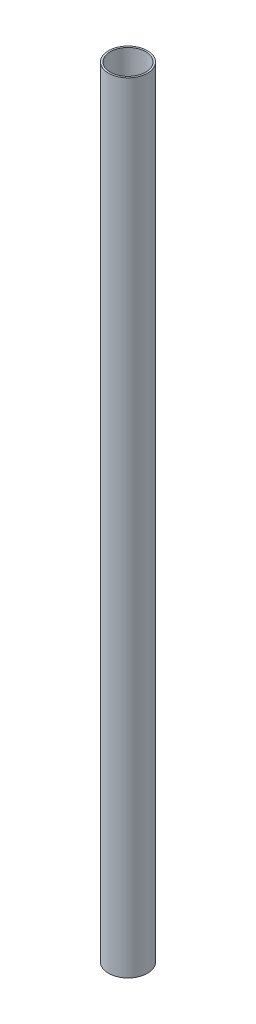
from build123d import *

# Parameters (mm, degrees)
SKETCH1_R      = 11
SKETCH1_R_2    = 10
EXTRUDE1_DEPTH = 220


with BuildPart() as part:
    # Sketch1 → Extrude1 (new, symmetric)
    with BuildSketch(Plane(origin=(0, 0, 0), x_dir=(1, 0, 0), z_dir=(0, 1, 0))):
        Circle(SKETCH1_R)
        Circle(SKETCH1_R_2, mode=Mode.SUBTRACT)
    extrude(amount=EXTRUDE1_DEPTH, both=True)


solid = part.part
